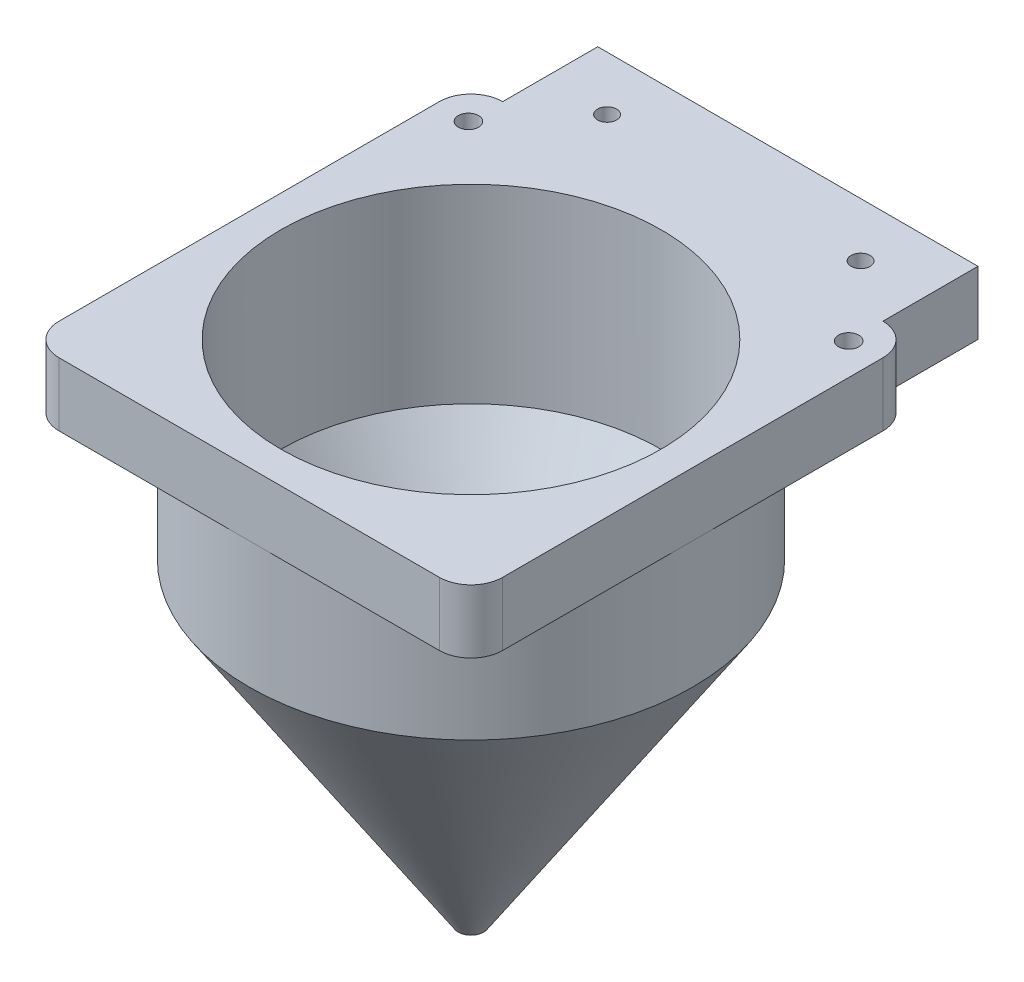
from build123d import *

# Parameters (mm, degrees)
SKETCH1_R                = 35
SKETCH1_R_2              = 30
BOSS_EXTRUDE1_DEPTH      = 30
BOSS_EXTRUDE2_REACH      = 94.871
BOSS_EXTRUDE2_END_RADIUS = 35
SKETCH4_W                = 70
SKETCH4_H                = 10
SKETCH5_R                = 1.6
CUT_EXTRUDE1_DEPTH       = 95.074438611
FILLET1_R                = 5
SKETCH7_W                = 60
SKETCH7_H                = 10
BOSS_EXTRUDE3_DEPTH      = 15
SKETCH6_R                = 1.5
CUT_EXTRUDE2_DEPTH       = 15


# Read off the part's stored shape, not the designer's step: Split2
with BuildPart() as part:
    # Sketch1 → Boss-Extrude1 (new body)
    with BuildSketch(Plane(origin=(0, 0, 0), x_dir=(1, 0, 0), z_dir=(0, 1, 0))):
        with Locations(Location((0, 0, 0), (0, 0, 270))):
            Circle(SKETCH1_R)
        with Locations(Location((0, 0, 0), (0, 0, 270))):
            Circle(SKETCH1_R_2, mode=Mode.SUBTRACT)
    extrude(amount=BOSS_EXTRUDE1_DEPTH)

    # Sketch3 → Revolve1 (revolve)
    with BuildSketch(Plane.XY, mode=Mode.PRIVATE) as revolve1_sk:
        Polygon((2, -50), (35, 0), (30, 0), (2, -45), (0, -45), (0, -50), align=None)
    revolve(revolve1_sk.sketch.rotate(Axis((0, 0, 0), (0, -1, 0)), 180), axis=Axis((0, 0, 0), (0, -1, 0)))


with BuildPart() as body_2:
    # Split1: the piece on the far side of the plane
    add(part.part)
    split(bisect_by=Plane(origin=(0, 0, 0), x_dir=(0, 0, 1), z_dir=(1, 0, 0)), keep=Keep.BOTTOM)


with BuildPart() as part_1:
    add(part.part)

    # Split1
    split(bisect_by=Plane(origin=(0, 0, 0), x_dir=(0, 0, 1), z_dir=(1, 0, 0)), keep=Keep.TOP)

    add(body_2.part)  # Boss-Extrude2 merges body 2
    # Boss-Extrude2: up to this cylinder (the profile starts outside it)
    boss_extrude2_end = Plane(origin=(0, 25, 0), z_dir=(0, -1, 0)) * Cylinder(BOSS_EXTRUDE2_END_RADIUS, 260.742, mode=Mode.PRIVATE)
    # Sketch4 → Boss-Extrude2 (add, up to the surface)
    with BuildSketch(Plane(origin=(35, 0, 0), x_dir=(0, 0, -1), z_dir=(1, 0, 0)), mode=Mode.PRIVATE) as boss_extrude2_sk1:
        with Locations((0, 25)):
            Rectangle(SKETCH4_W, SKETCH4_H)
    boss_extrude2_tool1 = extrude(boss_extrude2_sk1.sketch, amount=-BOSS_EXTRUDE2_REACH, mode=Mode.PRIVATE) - boss_extrude2_end
    boss_extrude2 = boss_extrude2_tool1.solids().sort_by_distance((35, 25, 0))[0] + boss_extrude2_tool1.solids().sort_by_distance((35, 25, 0))[1]
    add(boss_extrude2)

    # Mirror1: Boss-Extrude2 across plane
    add(boss_extrude2.mirror(Plane(origin=(0, 0, 0), x_dir=(0, 0, 1), z_dir=(1, 0, 0))))

    # Sketch5 → Cut-Extrude1 (cut, through all)
    with BuildSketch(Plane(origin=(0, 30, 0), x_dir=(1, 0, 0), z_dir=(0, 1, 0))):
        with Locations(Location((-30, 29.59590276, 0), (0, 0, 270))):
            Circle(SKETCH5_R)
        with Locations(Location((30, 29.59590276, 0), (0, 0, 270))):
            Circle(SKETCH5_R)
    extrude(amount=-CUT_EXTRUDE1_DEPTH, mode=Mode.SUBTRACT)

    # Fillet1
    fillet1_edges = [part_1.edges().sort_by_distance(p)[0] for p in [
        (35, 25, -35),
        (35, 25, 35),
        (-35, 25, 35),
        (-35, 25, -35),
    ]]
    fillet(fillet1_edges, radius=FILLET1_R)


with BuildPart() as body_2_2:
    # Split2: the piece on the far side of the plane
    add(part_1.part)
    split(bisect_by=Plane.YZ, keep=Keep.BOTTOM)


with BuildPart() as part_2:
    add(part_1.part)

    # Split2
    split(bisect_by=Plane.YZ, keep=Keep.TOP)

    add(body_2_2.part)  # Boss-Extrude3 merges body 2 2
    # Sketch7 → Boss-Extrude3 (add)
    with BuildSketch(Plane(origin=(0, 0, -35), x_dir=(-1, 0, 0), z_dir=(0, 0, -1))):
        with Locations((0, 25)):
            Rectangle(SKETCH7_W, SKETCH7_H)
    extrude(amount=BOSS_EXTRUDE3_DEPTH)

    # Sketch6 → Cut-Extrude2 (cut)
    with BuildSketch(Plane(origin=(0, 30, 0), x_dir=(1, 0, 0), z_dir=(0, 1, 0))):
        with Locations(Location((-20, 41.471784691, 0), (0, 0, 270))):
            Circle(SKETCH6_R)
        with Locations(Location((20, 41.471784691, 0), (0, 0, 270))):
            Circle(SKETCH6_R)
    extrude(amount=-CUT_EXTRUDE2_DEPTH, mode=Mode.SUBTRACT)


solid = part_2.part
